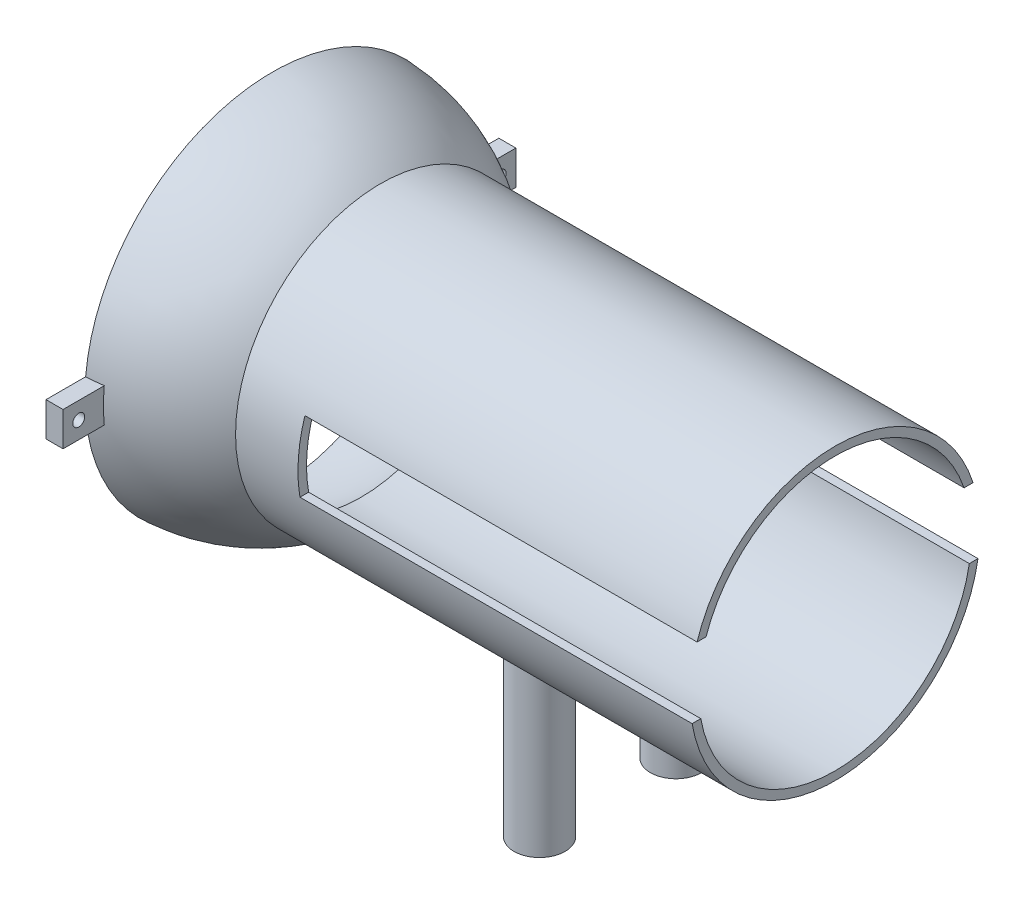
from build123d import *

# Parameters (mm, degrees)
CUT_EXTRUDE1_DEPTH              = 85
CUT_EXTRUDE1_DEPTH_BACK         = 30
SKETCH2_R                       = 42.5
BOSS_EXTRUDE1_DEPTH             = 135
BOSS_EXTRUDE1_DEPTH_BACK        = 4
SKETCH3_R                       = 42.5
SKETCH3_R_2                     = 40
CUT_EXTRUDE2_START              = -115
CUT_EXTRUDE2_DEPTH              = 115
BOSS_EXTRUDE3_REACH             = 208.879
BOSS_EXTRUDE3_END_RADIUS        = 42.5
SKETCH7_R                       = 7.5
BOSS_EXTRUDE3_DIRECTION_2_DEPTH = 23
SKETCH8_R                       = 1.75
BOSS_EXTRUDE4_DEPTH             = 5


# Read off the part's stored shape, not the designer's step: Shell1
with BuildPart() as part:
    # Sketch1 → Revolve1 (revolve)
    with BuildSketch(Plane(origin=(0, 0, 0), x_dir=(1, 0, 0), z_dir=(0, 1, 0))):
        with BuildLine():
            Line((0, 0), (50, 0))
            ThreePointArc((50, 0), (36.43816018, 37.898327436), (0, 55))
            Line((0, 55), (0, 0))
        make_face()
    revolve(axis=Axis((0, 0, 0), (1, 0, 0)))

    # Shell1 outline → Shell1 (revolve, cut)
    with BuildSketch(Plane.YX):
        with BuildLine():
            add(Edge.make_bspline(
                [(51.396143239, 0), (50.757559449, 13.308797838), (45.305252471, 29.157669604), (32.638691052, 41.565710517), (16.262834021, 46.466854434), (2.111028419, 46.466854274), (1.578625505, 46.459517426), (1.049215582, 46.444998454), (0.522958084, 46.423458206), (0, 46.395061716)],
                knots=[4.717788708, 4.717788708, 4.717788708, 4.717788708, 4.717788708, 4.717788708, 6.23524, 6.23524, 6.23524, 6.23524, 6.294886198, 6.294886198, 6.294886198, 6.294886198, 6.294886198, 6.294886198], degree=5, weights=[1, 1, 0.970217445, 0.968892719, 1, 1, 1.000000024, 1.000000027, 1, 1]))
            Line((0, 46.395061716), (0, 0))
            Line((0, 0), (51.396143239, 0))
        make_face()
    revolve(axis=Axis((0, 0, 0), (1, 0, 0)), mode=Mode.SUBTRACT)

    # Sketch2 → Cut-Extrude1 (cut, two sides: drawn at the far end of the back side and taken through both)
    with BuildSketch(Plane(origin=(30, 0, 0), x_dir=(0, 0, -1), z_dir=(1, 0, 0)).offset(-CUT_EXTRUDE1_DEPTH_BACK)):
        with Locations(Location((0, 0, 0), (0, 0, 180))):
            Circle(SKETCH2_R)
    extrude(amount=CUT_EXTRUDE1_DEPTH + CUT_EXTRUDE1_DEPTH_BACK, mode=Mode.SUBTRACT)

    # Sketch3 → Boss-Extrude1 (add, two sides: drawn at the far end of the back side and taken through both)
    with BuildSketch(Plane(origin=(30, 0, 0), x_dir=(0, 0, -1), z_dir=(1, 0, 0)).offset(-BOSS_EXTRUDE1_DEPTH_BACK)):
        with Locations(Location((0, 0, 0), (0, 0, 180))):
            Circle(SKETCH3_R)
        Circle(SKETCH3_R_2, mode=Mode.SUBTRACT)
    extrude(amount=BOSS_EXTRUDE1_DEPTH + BOSS_EXTRUDE1_DEPTH_BACK)

    # Sketch4 → Cut-Extrude2 (cut)
    with BuildSketch(Plane(origin=(165, 0, 0), x_dir=(0, 0, -1), z_dir=(1, 0, 0)).offset(CUT_EXTRUDE2_START)):
        with BuildLine():
            Line((45.575841937, 12.978925493), (40.46971081, 12.978925493))
            ThreePointArc((40.46971081, 12.978925493), (41.989360018, 6.568382243), (42.5, 0))
            ThreePointArc((42.5, 0), (42.353758703, -3.522658622), (41.916041234, -7.021074507))
            Line((41.916041234, -7.021074507), (45.575841937, -7.021074507))
            Line((45.575841937, -7.021074507), (45.575841937, 12.978925493))
        make_face()
        with BuildLine():
            ThreePointArc((40, 0), (39.455239564, 6.579063078), (37.835796451, 12.978925493))
            Line((37.835796451, 12.978925493), (35.575841937, 12.978925493))
            Line((35.575841937, 12.978925493), (35.575841937, 2.978925493))
            Line((35.575841937, 2.978925493), (35.575841937, -7.021074507))
            Line((35.575841937, -7.021074507), (39.378985675, -7.021074507))
            ThreePointArc((39.378985675, -7.021074507), (39.844443948, -3.524242686), (40, 0))
        make_face()
        with BuildLine():
            ThreePointArc((42.5, 0), (41.989360018, 6.568382243), (40.46971081, 12.978925493))
            Line((40.46971081, 12.978925493), (37.835796451, 12.978925493))
            ThreePointArc((37.835796451, 12.978925493), (39.455239564, 6.579063078), (40, 0))
            ThreePointArc((40, 0), (39.844443948, -3.524242686), (39.378985675, -7.021074507))
            Line((39.378985675, -7.021074507), (41.916041234, -7.021074507))
            ThreePointArc((41.916041234, -7.021074507), (42.353758703, -3.522658622), (42.5, 0))
        make_face()
        with BuildLine():
            Line((-37.835796451, 12.978925493), (-40.46971081, 12.978925493))
            ThreePointArc((-40.46971081, 12.978925493), (-42.389303309, 3.065446952), (-41.916041234, -7.021074507))
            Line((-41.916041234, -7.021074507), (-39.378985675, -7.021074507))
            ThreePointArc((-39.378985675, -7.021074507), (-39.881457404, 3.077231765), (-37.835796451, 12.978925493))
        make_face()
        with BuildLine():
            Line((-35.575841937, 12.978925493), (-37.835796451, 12.978925493))
            ThreePointArc((-37.835796451, 12.978925493), (-39.881457404, 3.077231765), (-39.378985675, -7.021074507))
            Line((-39.378985675, -7.021074507), (-35.575841937, -7.021074507))
            Line((-35.575841937, -7.021074507), (-35.575841937, 2.978925493))
            Line((-35.575841937, 2.978925493), (-35.575841937, 12.978925493))
        make_face()
    extrude(amount=CUT_EXTRUDE2_DEPTH, mode=Mode.SUBTRACT)

    # Boss-Extrude3: up to this cylinder (the profile starts outside it)
    boss_extrude3_end = Plane(origin=(98.345618, 0, 0), z_dir=(-1, 0, 0)) * Cylinder(BOSS_EXTRUDE3_END_RADIUS, 503.758, mode=Mode.PRIVATE)
    # Sketch7 → Boss-Extrude3 (add, up to the surface)
    with BuildSketch(Plane(origin=(0, -57.021074507, 0), x_dir=(-1, 0, 0), z_dir=(0, -1, 0)), mode=Mode.PRIVATE) as boss_extrude3_sk1:
        with Locations(Location((-98.345617605, 20, 0), (0, 0, 270))):
            Circle(SKETCH7_R)
    boss_extrude3_tool1 = extrude(boss_extrude3_sk1.sketch, amount=-BOSS_EXTRUDE3_REACH, mode=Mode.PRIVATE) - boss_extrude3_end
    add(boss_extrude3_tool1.solids().sort_by_distance((98.345618, -57.021075, -20))[0])
    # Sketch7 → Boss-Extrude3 (add, up to the surface)
    with BuildSketch(Plane(origin=(0, -57.021074507, 0), x_dir=(-1, 0, 0), z_dir=(0, -1, 0)), mode=Mode.PRIVATE) as boss_extrude3_sk2:
        with Locations(Location((-98.345617605, -20, 0), (0, 0, 270))):
            Circle(SKETCH7_R)
    boss_extrude3_tool2 = extrude(boss_extrude3_sk2.sketch, amount=-BOSS_EXTRUDE3_REACH, mode=Mode.PRIVATE) - boss_extrude3_end
    add(boss_extrude3_tool2.solids().sort_by_distance((98.345618, -57.021075, 20))[0])

    # Sketch7 → Boss-Extrude3 direction 2 (add)
    with BuildSketch(Plane(origin=(0, -57.021074507, 0), x_dir=(-1, 0, 0), z_dir=(0, -1, 0))):
        with Locations(Location((-98.345617605, 20, 0), (0, 0, 270))):
            Circle(SKETCH7_R)
        with Locations(Location((-98.345617605, -20, 0), (0, 0, 270))):
            Circle(SKETCH7_R)
    extrude(amount=BOSS_EXTRUDE3_DIRECTION_2_DEPTH)

    # Sketch8 → Boss-Extrude4 (add)
    # profile 1 of 2: a face of its own
    with BuildSketch(Plane.ZY):
        Polygon((66.396143239, 0), (66.396143239, 5), (51.152356151, 5), (51.396143239, 0), (51.152356151, -5), (66.396143239, -5), align=None)
        with Locations((61.79005008, 0)):
            Circle(SKETCH8_R, mode=Mode.SUBTRACT)
    # profile 2 of 2: a face of its own
    with BuildSketch(Plane.ZY):
        Polygon((-51.152356151, -5), (-51.396143239, 0), (-51.152356151, 5), (-66.396143239, 5), (-66.396143239, 0), (-66.396143239, -5), align=None)
        with Locations((-61.79005008, 0)):
            Circle(SKETCH8_R, mode=Mode.SUBTRACT)
    extrude(amount=-BOSS_EXTRUDE4_DEPTH)


solid = part.part
